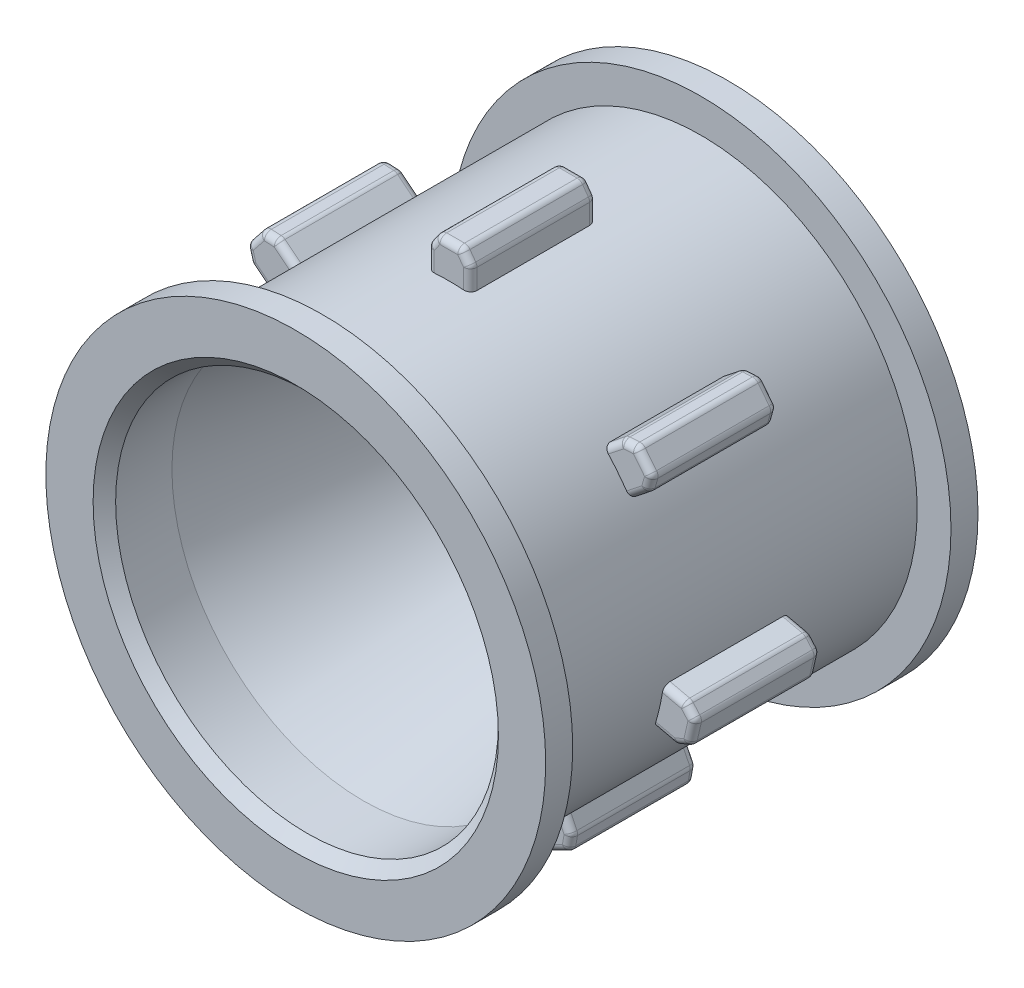
from build123d import *
from OCP.BRepFilletAPI import BRepFilletAPI_MakeChamfer

# Parameters (mm, degrees)
LAUFRAD_DEPTH                   = 8.4
LAUFRAD_DEPTH_BACK              = 8.4
SKIZZE1_R                       = 9.6
SKIZZE2_R                       = 11.1
KETTENF_HRUNG_DEPTH             = 1.2
SKIZZE4_R                       = 1
SCHRAUBENBOHRUNG_M3_DEPTH       = 25.800403223
SKIZZE3_R                       = 4.1
KUGELLAGERSITZ_DEPTH            = 2
FASE1_SIZE                      = 0.1
ZAHN_DEPTH                      = 2.8
VERRUNDUNG1_R                   = 0.3
KREISMUSTER1_COUNT              = 7
VERRUNDUNG1_OF_KREISMUSTER1_R   = 0.3
SKIZZE8_W                       = 4.2
SKIZZE8_H                       = 17.4
AUSCHNITT_ANTRIEB_WAGE_DEPTH    = 2
SKIZZE10_W                      = 17
SKIZZE10_H                      = 7.6
SCHNITT_LINEAR_AUSTRAGEN2_DEPTH = 2
FASE2_SIZE                      = 0.5
FASE2_SIZE2                     = 0.641933689


with BuildPart() as part:
    # Skizze1 → Laufrad (new, two sides: drawn at the far end of the back side and taken through both)
    with BuildSketch(Plane.XY.offset(-LAUFRAD_DEPTH_BACK)):
        Circle(SKIZZE1_R)
    extrude(amount=LAUFRAD_DEPTH + LAUFRAD_DEPTH_BACK)

    # Skizze2 → Kettenführung (add)
    with BuildSketch(Plane.XY.offset(8.4)):
        Circle(SKIZZE2_R)
    kettenf_hrung = extrude(amount=KETTENF_HRUNG_DEPTH)

    # Spiegeln Kettenführung: Kettenführung across plane
    add(kettenf_hrung.mirror(Plane.XY))

    # Skizze4 → SchraubenBohrung M3 (cut, through all)
    with BuildSketch(Plane(origin=(0, 0, -9.6), x_dir=(-1, 0, 0), z_dir=(0, 0, -1))):
        Circle(SKIZZE4_R)
    extrude(amount=-SCHRAUBENBOHRUNG_M3_DEPTH, mode=Mode.SUBTRACT)

    # Skizze3 → Kugellagersitz (cut)
    with BuildSketch(Plane(origin=(0, 0, -9.6), x_dir=(-1, 0, 0), z_dir=(0, 0, -1))):
        Circle(SKIZZE3_R)
    extrude(amount=-KUGELLAGERSITZ_DEPTH, mode=Mode.SUBTRACT)

    # Skizze5 → Schnitt-Rotation3 (revolve, cut)
    with BuildSketch(Plane(origin=(0, 0, 0), x_dir=(0, 0, -1), z_dir=(1, 0, 0))):
        Polygon((-9.6, 0), (-9.6, 8.5), (-6.6, 8.5), (5.6, 6), (5.6, 0), align=None)
    revolve(axis=Axis((0, 0, -8.4), (0, 0, 1)), mode=Mode.SUBTRACT)

    # Fase1
    fase1_edges = [part.edges().sort_by_distance(p)[0] for p in [
        (1, 0, -5.6),
    ]]
    chamfer(fase1_edges, length=FASE1_SIZE)

    # Skizze6 → Zahn (add, symmetric)
    with BuildSketch(Plane.XY):
        Polygon((0.55, 11.1), (-0.55, 11.1), (-0.95, 10.542409848), (-0.95, 9.552879147), (0.95, 9.552879147), (0.95, 10.542409848), align=None)
    zahn = extrude(amount=ZAHN_DEPTH, both=True)

    # Verrundung1
    verrundung1_edges = [part.edges().sort_by_distance(p)[0] for p in [
        (0.95, 10.542409848, 0),
        (-0.95, 10.542409848, 0),
        (-0.95, 10.047644498, -2.8),
        (-0.75, 10.821204924, -2.8),
        (0, 11.1, -2.8),
        (0.75, 10.821204924, -2.8),
        (0.95, 10.047644498, -2.8),
        (-0.55, 11.1, 0),
        (0.55, 11.1, 0),
        (-0.95, 10.047644498, 2.8),
        (-0.75, 10.821204924, 2.8),
        (0, 11.1, 2.8),
        (0.75, 10.821204924, 2.8),
        (0.95, 10.047644498, 2.8),
    ]]
    fillet(verrundung1_edges, radius=VERRUNDUNG1_R)

    # Kreismuster1: Zahn ×7 about axis
    kreismuster1_axis = Axis((0, 0, -8.4), (0, 0, 1))
    for i in range(1, KREISMUSTER1_COUNT):
        add(zahn.rotate(kreismuster1_axis, i * 360 / KREISMUSTER1_COUNT))

    # Verrundung1 of Kreismuster1
    verrundung1_of_kreismuster1_edges = [part.edges().sort_by_distance(p)[0] for p in [
        (-7.650072609, 7.315824936, 0),
        (-8.834703232, 5.830345119, 0),
        (-8.447880105, 5.521863969, -2.8),
        (-8.927976039, 6.160537302, -2.8),
        (-8.678329455, 6.920736801, -2.8),
        (-7.992741337, 7.333284526, -2.8),
        (-7.263249481, 7.007343785, -2.8),
        (-9.021248846, 6.490729485, 0),
        (-8.335410064, 7.350744116, 0),
        (-8.447880105, 5.521863969, 2.8),
        (-8.927976039, 6.160537302, 2.8),
        (-8.678329455, 6.920736801, 2.8),
        (-7.992741337, 7.333284526, 2.8),
        (-7.263249481, 7.007343785, 2.8),
        (-10.48948451, -1.419725369, 0),
        (-10.066694735, -3.272088402, 0),
        (-9.584334185, -3.161992754, -2.8),
        (-10.383004023, -3.13914056, -2.8),
        (-10.821699825, -2.469982367, -2.8),
        (-10.716785424, -1.676748692, -2.8),
        (-10.00712396, -1.309629721, -2.8),
        (-10.699313312, -3.006192719, 0),
        (-10.944086339, -1.933772015, 0),
        (-9.584334185, -3.161992754, 2.8),
        (-10.383004023, -3.13914056, 2.8),
        (-10.821699825, -2.469982367, 2.8),
        (-10.716785424, -1.676748692, 2.8),
        (-10.00712396, -1.309629721, 2.8),
        (-5.430100629, -9.086193514, 0),
        (-3.71825978, -9.910572618, 0),
        (-3.503589139, -9.46480444, -2.8),
        (-4.019418203, -10.074981554, -2.8),
        (-4.816109504, -10.000754434, -2.8),
        (-5.370871505, -9.424155945, -2.8),
        (-5.215429988, -8.640425336, -2.8),
        (-4.320576627, -10.23939049, 0),
        (-5.311642382, -9.762118377, 0),
        (-3.503589139, -9.46480444, 2.8),
        (-4.019418203, -10.074981554, 2.8),
        (-4.816109504, -10.000754434, 2.8),
        (-5.370871505, -9.424155945, 2.8),
        (-5.215429988, -8.640425336, 2.8),
        (3.71825978, -9.910572618, 0),
        (5.430100629, -9.086193514, 0),
        (5.215429988, -8.640425336, -2.8),
        (5.370871505, -9.424155945, -2.8),
        (4.816109504, -10.000754434, -2.8),
        (4.019418203, -10.074981554, -2.8),
        (3.503589139, -9.46480444, -2.8),
        (5.311642382, -9.762118377, 0),
        (4.320576627, -10.23939049, 0),
        (5.215429988, -8.640425336, 2.8),
        (5.370871505, -9.424155945, 2.8),
        (4.816109504, -10.000754434, 2.8),
        (4.019418203, -10.074981554, 2.8),
        (3.503589139, -9.46480444, 2.8),
        (10.066694735, -3.272088402, 0),
        (10.48948451, -1.419725369, 0),
        (10.00712396, -1.309629721, -2.8),
        (10.716785424, -1.676748692, -2.8),
        (10.821699825, -2.469982367, -2.8),
        (10.383004023, -3.13914056, -2.8),
        (9.584334185, -3.161992754, -2.8),
        (10.944086339, -1.933772015, 0),
        (10.699313312, -3.006192719, 0),
        (10.00712396, -1.309629721, 2.8),
        (10.716785424, -1.676748692, 2.8),
        (10.821699825, -2.469982367, 2.8),
        (10.383004023, -3.13914056, 2.8),
        (9.584334185, -3.161992754, 2.8),
        (8.834703232, 5.830345119, 0),
        (7.650072609, 7.315824936, 0),
        (7.263249481, 7.007343785, -2.8),
        (7.992741337, 7.333284526, -2.8),
        (8.678329455, 6.920736801, -2.8),
        (8.927976039, 6.160537302, -2.8),
        (8.447880105, 5.521863969, -2.8),
        (8.335410064, 7.350744116, 0),
        (9.021248846, 6.490729485, 0),
        (7.263249481, 7.007343785, 2.8),
        (7.992741337, 7.333284526, 2.8),
        (8.678329455, 6.920736801, 2.8),
        (8.927976039, 6.160537302, 2.8),
        (8.447880105, 5.521863969, 2.8),
    ]]
    fillet(verrundung1_of_kreismuster1_edges, radius=VERRUNDUNG1_OF_KREISMUSTER1_R)

    # Skizze8 → Auschnitt Antrieb Wage (cut)
    with BuildSketch(Plane(origin=(0, 0, -9.6), x_dir=(-1, 0, 0), z_dir=(0, 0, -1))):
        Rectangle(SKIZZE8_W, SKIZZE8_H)
    extrude(amount=-AUSCHNITT_ANTRIEB_WAGE_DEPTH, mode=Mode.SUBTRACT)

    # Skizze10 → Schnitt-Linear austragen2 (cut)
    with BuildSketch(Plane(origin=(0, 0, -9.6), x_dir=(-1, 0, 0), z_dir=(0, 0, -1))):
        Rectangle(SKIZZE10_W, SKIZZE10_H)
    extrude(amount=-SCHNITT_LINEAR_AUSTRAGEN2_DEPTH, mode=Mode.SUBTRACT)

    # Fase2: one chamfer whose edges measure the first distance from different faces: ONE call of the kernel's chamfer builder (chamfer() names one face for all edges)
    fase2_edges_1 = [part.edges().sort_by_distance(p)[0] for p in [
        (0, -6, -5.6),
    ]]
    fase2_side_1 = [part.faces().sort_by_distance(p)[0] for p in [
        (1.269705627, 0, -5.6),
    ]]
    fase2_edges_2 = [part.edges().sort_by_distance(p)[0] for p in [
        (0, -8.5, 9.6),
    ]]
    fase2 = BRepFilletAPI_MakeChamfer(part.part.solid().wrapped)
    for e in fase2_edges_1:
        fase2.Add(FASE2_SIZE, FASE2_SIZE2, e.wrapped, fase2_side_1[0].wrapped)  # the first distance lies on this face
    for e in fase2_edges_2:
        fase2.Add(FASE2_SIZE, e.wrapped)
    add(Compound.cast(fase2.Shape()), mode=Mode.REPLACE)


solid = part.part
